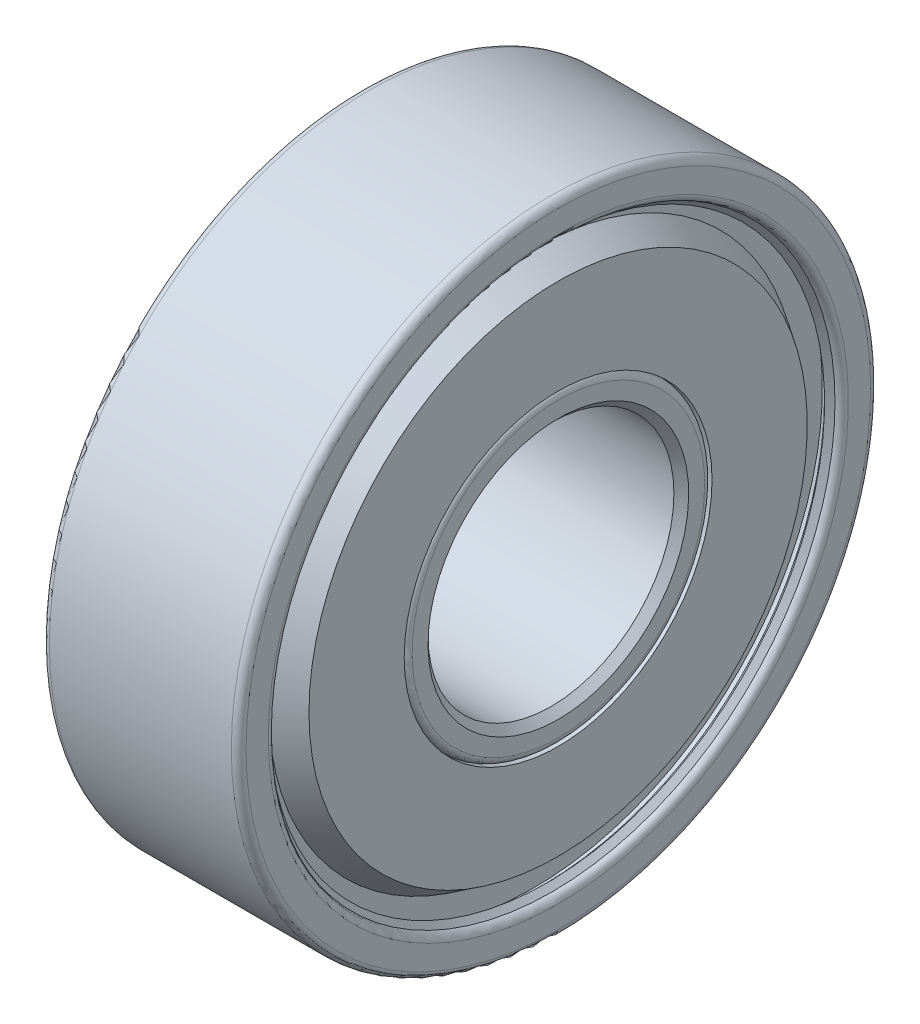
from build123d import *

# Parameters (mm, degrees)
RACCORDO1_R                 = 0.3
RACCORDO2_R                 = 0.3
SMUSSO1_SIZE                = 0.3
RIPETIZIONECIRCOLARE1_COUNT = 10


with BuildPart() as part:
    # Schizzo2 → Rivoluzione1 (revolve)
    with BuildSketch(Plane.XY, mode=Mode.PRIVATE) as rivoluzione1_sk:
        with BuildLine():
            Line((4, 13), (-4, 13))
            Line((-4, 13), (-4, 11.5))
            Line((-4, 11.5), (-3.75, 11.5))
            Line((-3.75, 11.5), (-3.261662579, 11.98642151))
            Line((-3.261662579, 11.98642151), (-2.75, 11.98642151))
            Line((-2.75, 11.98642151), (-2.75, 10.63642151))
            Line((-2.75, 10.63642151), (-1.544222989, 10.63642151))
            ThreePointArc((-1.544222989, 10.63642151), (0, 11.25), (1.544222989, 10.63642151))
            Line((1.544222989, 10.63642151), (2.75, 10.63642151))
            Line((2.75, 10.63642151), (2.75, 11.98642151))
            Line((2.75, 11.98642151), (3.261662579, 11.98642151))
            Line((3.261662579, 11.98642151), (3.75, 11.5))
            Line((3.75, 11.5), (4, 11.5))
            Line((4, 11.5), (4, 13))
        make_face()
    revolve(rivoluzione1_sk.sketch.rotate(Axis((-4, 0, 0), (1, 0, 0)), 90), axis=Axis((-4, 0, 0), (1, 0, 0)))

    # Raccordo1
    # the kernel refuses this fillet: 0.3 mm, written as the material it takes off along each edge
    with BuildSketch(Plane(origin=(-4, 0, 0), x_dir=(0, 0, 1), z_dir=(0, 1, 0))) as raccordo1_piece_1:
        with BuildLine():
            CenterArc((11.795803989, 0.3), RACCORDO1_R, 189.594068227, 80.405931773)
            Line((11.5, 0.25), (11.49408392, 0.249))
            ThreePointArc((11.49408392, 0.249), (11.494, 0.125), (11.494, 0))
            Line((11.494, 0), (11.5, -0.006))
            Line((11.5, -0.006), (11.795803989, -0.006))
            Line((11.795803989, -0.006), (11.795803989, 0))
        make_face()
    revolve(axis=Axis((-4, 0, 0), (1, 0, 0)), mode=Mode.SUBTRACT)
    with BuildSketch(Plane(origin=(-4, 0, 0), x_dir=(0, 0, 1), z_dir=(0, 1, 0))) as raccordo1_piece_2:
        with BuildLine():
            CenterArc((13 - RACCORDO1_R, RACCORDO1_R), RACCORDO1_R, 270, 90)
            Line((13 - RACCORDO1_R, 0), (13 - RACCORDO1_R, -RACCORDO1_R * 0.02))
            Line((13 - RACCORDO1_R, -RACCORDO1_R * 0.02), (13 + RACCORDO1_R * 0.02, -RACCORDO1_R * 0.02))
            Line((13 + RACCORDO1_R * 0.02, -RACCORDO1_R * 0.02), (13 + RACCORDO1_R * 0.02, RACCORDO1_R))
            Line((13 + RACCORDO1_R * 0.02, RACCORDO1_R), (13, RACCORDO1_R))
        make_face()
    revolve(axis=Axis((-4, 0, 0), (1, 0, 0)), mode=Mode.SUBTRACT)
    with BuildSketch(Plane(origin=(4, 0, 0), x_dir=(0, 0, 1), z_dir=(0, 1, 0))) as raccordo1_piece_3:
        with BuildLine():
            CenterArc((13 - RACCORDO1_R, -RACCORDO1_R), RACCORDO1_R, 0, 90)
            Line((13 - RACCORDO1_R, 0), (13 - RACCORDO1_R, RACCORDO1_R * 0.02))
            Line((13 - RACCORDO1_R, RACCORDO1_R * 0.02), (13 + RACCORDO1_R * 0.02, RACCORDO1_R * 0.02))
            Line((13 + RACCORDO1_R * 0.02, RACCORDO1_R * 0.02), (13 + RACCORDO1_R * 0.02, -RACCORDO1_R))
            Line((13 + RACCORDO1_R * 0.02, -RACCORDO1_R), (13, -RACCORDO1_R))
        make_face()
    revolve(axis=Axis((4, 0, 0), (1, 0, 0)), mode=Mode.SUBTRACT)
    with BuildSketch(Plane(origin=(4, 0, 0), x_dir=(0, 0, 1), z_dir=(0, 1, 0))) as raccordo1_piece_4:
        with BuildLine():
            CenterArc((11.795803989, -0.3), RACCORDO1_R, 90, 80.405931773)
            Line((11.795803989, 0), (11.795803989, 0.006))
            Line((11.795803989, 0.006), (11.5, 0.006))
            Line((11.5, 0.006), (11.494, 0))
            ThreePointArc((11.494, 0), (11.494, -0.125), (11.49408392, -0.249))
            Line((11.49408392, -0.249), (11.5, -0.25))
        make_face()
    revolve(axis=Axis((4, 0, 0), (1, 0, 0)), mode=Mode.SUBTRACT)


with BuildPart() as body_2:
    # Schizzo3 → Rivoluzione2 (revolve)
    with BuildSketch(Plane.XY, mode=Mode.PRIVATE) as rivoluzione2_sk:
        with BuildLine():
            Line((-2.75, 7.5), (-1.677050983, 7.5))
            ThreePointArc((-1.677050983, 7.5), (0, 6.75), (1.677050983, 7.5))
            Line((1.677050983, 7.5), (2.75, 7.5))
            Line((2.75, 7.5), (2.75, 6.25))
            Line((2.75, 6.25), (4, 6.25))
            Line((4, 6.25), (4, 5))
            Line((4, 5), (-4, 5))
            Line((-4, 5), (-4, 6.25))
            Line((-4, 6.25), (-2.75, 6.25))
            Line((-2.75, 6.25), (-2.75, 7.5))
        make_face()
    revolve(rivoluzione2_sk.sketch.rotate(Axis((-4, 0, 0), (1, 0, 0)), 180), axis=Axis((-4, 0, 0), (1, 0, 0)))

    # Raccordo2
    raccordo2_edges = [body_2.edges().sort_by_distance(p)[0] for p in [
        (-4, 6.25, 0),
        (4, 6.25, 0),
    ]]
    fillet(raccordo2_edges, radius=RACCORDO2_R)

    # Smusso1
    smusso1_edges = [body_2.edges().sort_by_distance(p)[0] for p in [
        (-4, 5, 0),
        (4, 5, 0),
    ]]
    chamfer(smusso1_edges, length=SMUSSO1_SIZE)


with BuildPart() as body_3:
    # Schizzo4 → Rivoluzione3 (revolve)
    with BuildSketch(Plane.XY):
        with BuildLine():
            Line((-2.2, 9), (2.2, 9))
            ThreePointArc((2.2, 9), (0, 11.2), (-2.2, 9))
        make_face()
    revolve(axis=Axis((-2.2, 9, 0), (1, 0, 0)))


with BuildPart() as ripetizionecircolare1_1:
    # RipetizioneCircolare1: pattern copy
    add(body_3.part.rotate(Axis((0, 0, 0), (1, 0, 0)), 1 * 360 / RIPETIZIONECIRCOLARE1_COUNT))


with BuildPart() as ripetizionecircolare1_2:
    # RipetizioneCircolare1: pattern copy
    add(body_3.part.rotate(Axis((0, 0, 0), (1, 0, 0)), 2 * 360 / RIPETIZIONECIRCOLARE1_COUNT))


with BuildPart() as ripetizionecircolare1_3:
    # RipetizioneCircolare1: pattern copy
    add(body_3.part.rotate(Axis((0, 0, 0), (1, 0, 0)), 3 * 360 / RIPETIZIONECIRCOLARE1_COUNT))


with BuildPart() as ripetizionecircolare1_4:
    # RipetizioneCircolare1: pattern copy
    add(body_3.part.rotate(Axis((0, 0, 0), (1, 0, 0)), 4 * 360 / RIPETIZIONECIRCOLARE1_COUNT))


with BuildPart() as ripetizionecircolare1_5:
    # RipetizioneCircolare1: pattern copy
    add(body_3.part.rotate(Axis((0, 0, 0), (1, 0, 0)), 5 * 360 / RIPETIZIONECIRCOLARE1_COUNT))


with BuildPart() as ripetizionecircolare1_6:
    # RipetizioneCircolare1: pattern copy
    add(body_3.part.rotate(Axis((0, 0, 0), (1, 0, 0)), 6 * 360 / RIPETIZIONECIRCOLARE1_COUNT))


with BuildPart() as ripetizionecircolare1_7:
    # RipetizioneCircolare1: pattern copy
    add(body_3.part.rotate(Axis((0, 0, 0), (1, 0, 0)), 7 * 360 / RIPETIZIONECIRCOLARE1_COUNT))


with BuildPart() as ripetizionecircolare1_8:
    # RipetizioneCircolare1: pattern copy
    add(body_3.part.rotate(Axis((0, 0, 0), (1, 0, 0)), 8 * 360 / RIPETIZIONECIRCOLARE1_COUNT))


with BuildPart() as ripetizionecircolare1_9:
    # RipetizioneCircolare1: pattern copy
    add(body_3.part.rotate(Axis((0, 0, 0), (1, 0, 0)), 9 * 360 / RIPETIZIONECIRCOLARE1_COUNT))


with BuildPart() as body_13:
    # Schizzo5 → Rivoluzione-Sottile1 (revolve)
    with BuildSketch(Plane.XY, mode=Mode.PRIVATE) as rivoluzione_sottile1_sk:
        Polygon((-3, 6.5), (-3.75, 6.5), (-3.75, 10), (-2.75, 10.63642151), (-2.75, 11.98642151), (-3.261662579, 11.98642151), (-3.75, 11.5), (-3.538285325, 11.287451426), (-3.368246466, 11.456823166), (-3.410589401, 11.499332881), (-3.162527542, 11.74642151), (-2.99, 11.74642151), (-2.99, 10.768162092), (-3.99, 10.131740582), (-3.99, 6.26), (-3, 6.26), align=None)
    revolve(rivoluzione_sottile1_sk.sketch.rotate(Axis((-4, 0, 0), (1, 0, 0)), 90), axis=Axis((-4, 0, 0), (1, 0, 0)))


with BuildPart() as body_14:
    # Specchia1: mirrored copy
    add(body_13.part.mirror(Plane(origin=(0, 0, 0), x_dir=(0, 0, 1), z_dir=(1, 0, 0))))


solid = Compound([part.part, body_2.part, body_3.part, ripetizionecircolare1_1.part, ripetizionecircolare1_2.part, ripetizionecircolare1_3.part, ripetizionecircolare1_4.part, ripetizionecircolare1_5.part, ripetizionecircolare1_6.part, ripetizionecircolare1_7.part, ripetizionecircolare1_8.part, ripetizionecircolare1_9.part, body_13.part, body_14.part])
